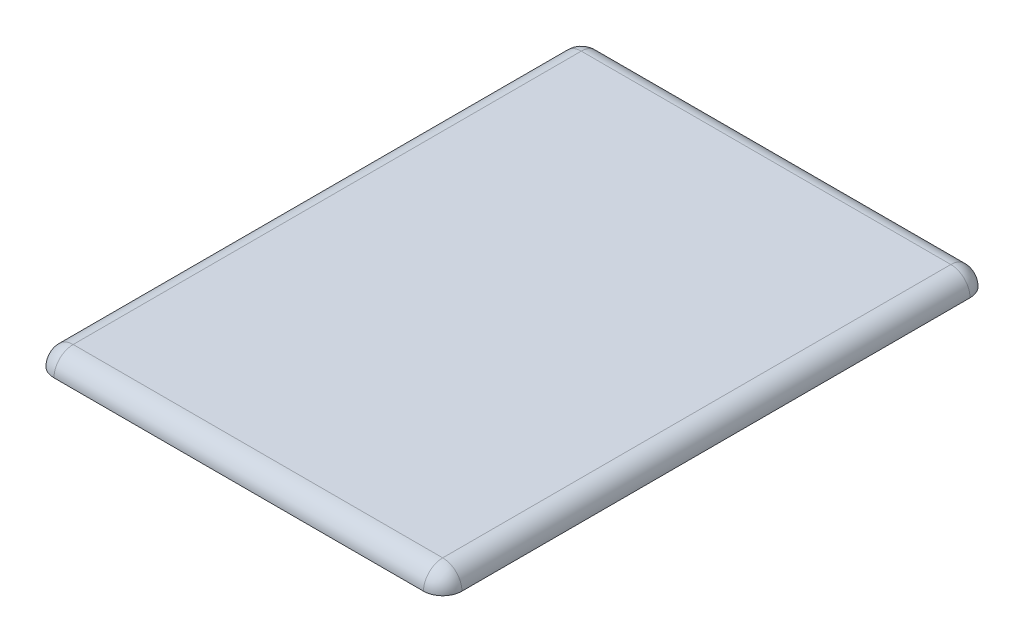
from build123d import *

# Parameters (mm, degrees)
SKETCH1_W           = 106
SKETCH1_H           = 142
BOSS_EXTRUDE1_DEPTH = 5
SKETCH2_W           = 90
SKETCH2_H           = 126
BOSS_EXTRUDE2_DEPTH = 5
SKETCH3_W           = 80
SKETCH3_H           = 116
CUT_EXTRUDE1_DEPTH  = 5
SKETCH4_W           = 25
SKETCH4_H           = 5
CUT_EXTRUDE2_DEPTH  = 5
FILLET1_R           = 5


with BuildPart() as part:
    # Sketch1 → Boss-Extrude1 (new body)
    with BuildSketch(Plane(origin=(0, 0, 0), x_dir=(1, 0, 0), z_dir=(0, 1, 0))):
        Rectangle(SKETCH1_W, SKETCH1_H)
    extrude(amount=BOSS_EXTRUDE1_DEPTH)

    # Sketch2 → Boss-Extrude2 (add)
    with BuildSketch(Plane.XZ):
        Rectangle(SKETCH2_W, SKETCH2_H)
    extrude(amount=BOSS_EXTRUDE2_DEPTH)

    # Sketch3 → Cut-Extrude1 (cut)
    with BuildSketch(Plane.XZ.offset(5)):
        Rectangle(SKETCH3_W, SKETCH3_H)
    extrude(amount=-CUT_EXTRUDE1_DEPTH, mode=Mode.SUBTRACT)

    # Sketch4 → Cut-Extrude2 (cut)
    with BuildSketch(Plane(origin=(45, 0, 0), x_dir=(0, 0, -1), z_dir=(1, 0, 0))):
        with Locations((0, -2.5)):
            Rectangle(SKETCH4_W, SKETCH4_H)
    extrude(amount=-CUT_EXTRUDE2_DEPTH, mode=Mode.SUBTRACT)

    # Fillet1
    fillet1_edges = [part.edges().sort_by_distance(p)[0] for p in [
        (-53, 5, 0),
        (0, 5, 71),
        (53, 5, 0),
        (53, 2.5, 71),
        (-53, 2.5, 71),
        (-53, 2.5, -71),
        (53, 2.5, -71),
        (0, 5, -71),
    ]]
    fillet(fillet1_edges, radius=FILLET1_R - 0.0001)  # a hair under: the kernel refuses the full size


solid = part.part
